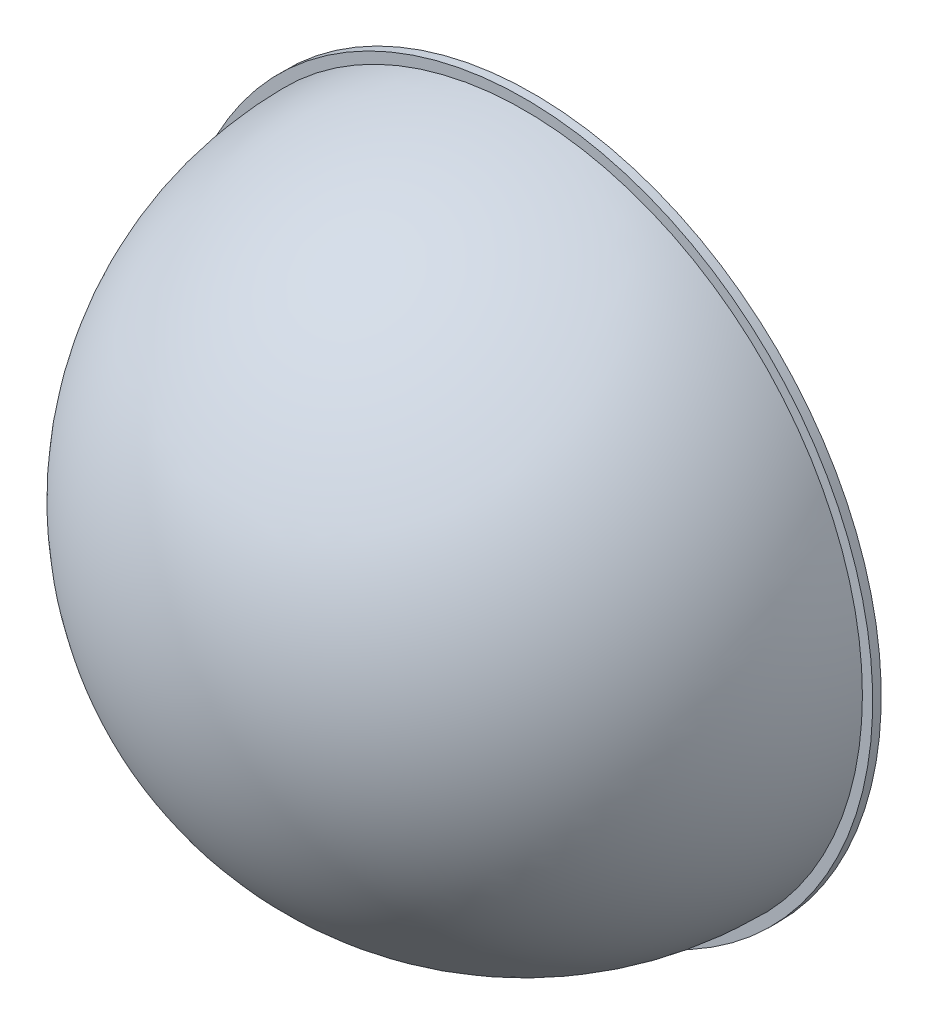
from build123d import *

# Parameters (mm, degrees)
SHELL1_T            = -2
SKETCH2_R           = 81.25
SKETCH2_R_2         = 76.85
BOSS_EXTRUDE1_DEPTH = 2


# Read off the part's stored shape, not the designer's step: Revolve1
with BuildPart() as part:
    # Revolve1 outline → Revolve1 (revolve)
    with BuildSketch(Plane.XZ):
        with BuildLine():
            Line((0, 0), (78.85, -7.9e-08))
            ThreePointArc((78.85, -7.9e-08), (55.755369724, 55.755369669), (0, 78.85))
            Line((0, 78.85), (0, 0))
        make_face()
    revolve(axis=Axis((0, 0, 0), (0, 0, 1)))

    # Shell1
    shell1_openings = [part.faces().sort_by_distance(p)[0] for p in [
        (0, 0, 0),
    ]]
    offset(amount=SHELL1_T, openings=shell1_openings, kind=Kind.INTERSECTION)

    # Sketch2 → Boss-Extrude1 (add)
    with BuildSketch(Plane(origin=(0, 0, 0), x_dir=(-1, 0, 0), z_dir=(0, 0, -1))):
        Circle(SKETCH2_R)
        Circle(SKETCH2_R_2, mode=Mode.SUBTRACT)
    extrude(amount=BOSS_EXTRUDE1_DEPTH)


solid = part.part
